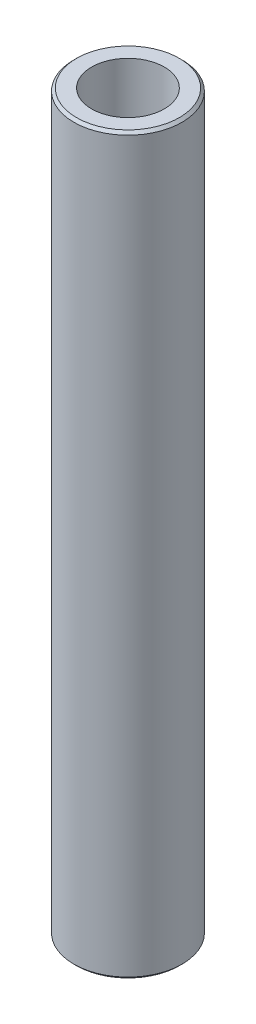
from build123d import *

# Parameters (mm, degrees)
SKETCH1_R           = 17.5
BOSS_EXTRUDE1_DEPTH = 237.653496643
SKETCH2_R           = 11.761611226
CUT_EXTRUDE1_DEPTH  = 239.938662562
CHAMFER1_SIZE       = 0.868543683


with BuildPart() as part:
    # Sketch1 → Boss-Extrude1 (new body)
    with BuildSketch(Plane(origin=(0, 0, 0), x_dir=(1, 0, 0), z_dir=(0, 1, 0))):
        Circle(SKETCH1_R)
    extrude(amount=BOSS_EXTRUDE1_DEPTH)

    # Sketch2 → Cut-Extrude1 (cut, through all)
    with BuildSketch(Plane(origin=(0, 0, 0), x_dir=(1, 0, 0), z_dir=(0, 1, 0))):
        Circle(SKETCH2_R)
    extrude(amount=CUT_EXTRUDE1_DEPTH, mode=Mode.SUBTRACT)

    # Chamfer1
    chamfer1_edges = [part.edges().sort_by_distance(p)[0] for p in [
        (-17.5, 237.653496643, 0),
        (-17.5, 0, 0),
    ]]
    chamfer(chamfer1_edges, length=CHAMFER1_SIZE)


solid = part.part
